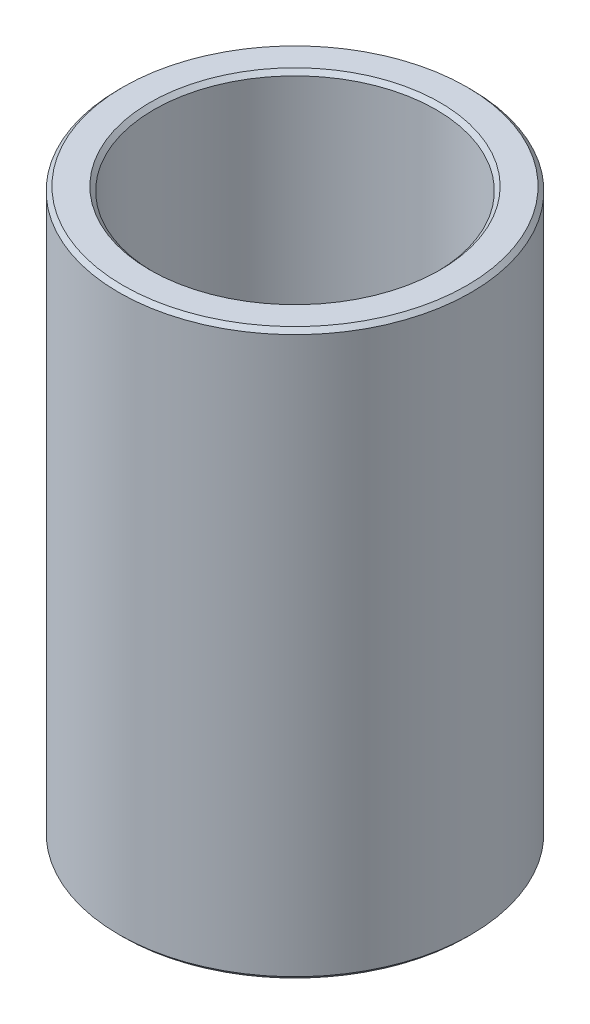
from build123d import *

# Parameters (mm, degrees)
SKETCH1_R           = 32.5
BOSS_EXTRUDE1_DEPTH = 104.188072764
SKETCH2_R           = 26.036636989
CUT_EXTRUDE1_DEPTH  = 114.875609796
CHAMFER1_SIZE       = 0.755256747


with BuildPart() as part:
    # Sketch1 → Boss-Extrude1 (new body)
    with BuildSketch(Plane(origin=(0, 0, 0), x_dir=(1, 0, 0), z_dir=(0, 1, 0))):
        Circle(SKETCH1_R)
    extrude(amount=BOSS_EXTRUDE1_DEPTH)

    # Sketch2 → Cut-Extrude1 (cut, through all)
    with BuildSketch(Plane(origin=(0, 0, 0), x_dir=(1, 0, 0), z_dir=(0, 1, 0))):
        Circle(SKETCH2_R)
    extrude(amount=CUT_EXTRUDE1_DEPTH, mode=Mode.SUBTRACT)

    # Chamfer1
    chamfer1_edges = [part.edges().sort_by_distance(p)[0] for p in [
        (-26.036636989, 104.188072764, 0),
        (-26.036636989, 0, 0),
        (-32.5, 0, 0),
        (-32.5, 104.188072764, 0),
    ]]
    chamfer(chamfer1_edges, length=CHAMFER1_SIZE)


solid = part.part
